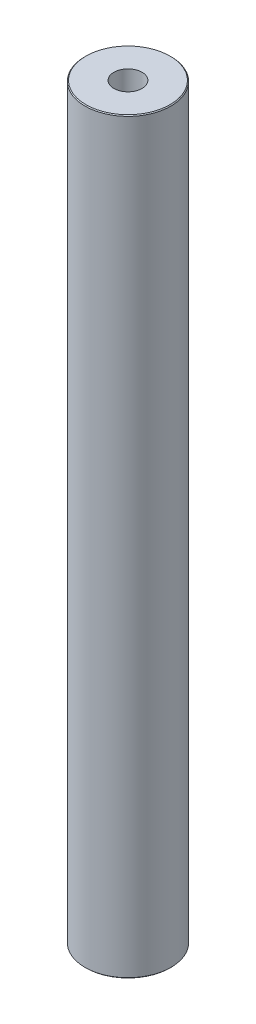
from build123d import *

# Parameters (mm, degrees)
SKETCH1_R           = 15
BOSS_EXTRUDE1_DEPTH = 261.244266934
SKETCH2_R           = 4.923961463
CUT_EXTRUDE1_DEPTH  = 263.104114821
CHAMFER1_SIZE       = 0.297142396


with BuildPart() as part:
    # Sketch1 → Boss-Extrude1 (new body)
    with BuildSketch(Plane(origin=(0, 0, 0), x_dir=(1, 0, 0), z_dir=(0, 1, 0))):
        Circle(SKETCH1_R)
    extrude(amount=BOSS_EXTRUDE1_DEPTH)

    # Sketch2 → Cut-Extrude1 (cut, through all)
    with BuildSketch(Plane(origin=(0, 0, 0), x_dir=(1, 0, 0), z_dir=(0, 1, 0))):
        Circle(SKETCH2_R)
    extrude(amount=CUT_EXTRUDE1_DEPTH, mode=Mode.SUBTRACT)

    # Chamfer1
    chamfer1_edges = [part.edges().sort_by_distance(p)[0] for p in [
        (-15, 261.244266934, 0),
        (-15, 0, 0),
    ]]
    chamfer(chamfer1_edges, length=CHAMFER1_SIZE)


solid = part.part
